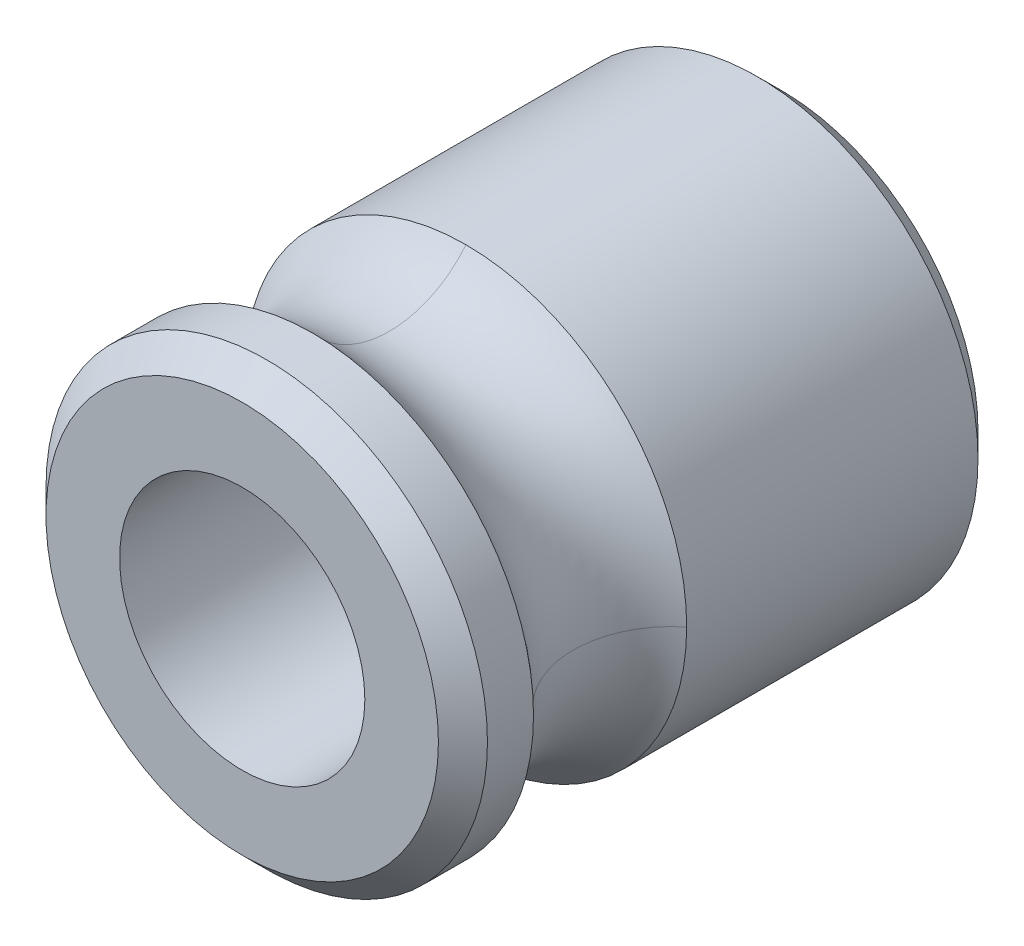
from build123d import *

# Parameters (mm, degrees)
CROQUIS1_R              = 4.5
CROQUIS1_R_2            = 2.5
SALIENTE_EXTRUIR1_DEPTH = 11
CHAFL_N1_SIZE           = 0.5


# Read off the part's stored shape, not the designer's step: Cortar-Barrer1
with BuildPart() as part:
    # Croquis1 → Saliente-Extruir1 (new body)
    with BuildSketch(Plane.XY):
        Circle(CROQUIS1_R)
        Circle(CROQUIS1_R_2, mode=Mode.SUBTRACT)
    extrude(amount=SALIENTE_EXTRUIR1_DEPTH)

    # Chaflán1
    chafl_n1_edges = [part.edges().sort_by_distance(p)[0] for p in [
        (-4.5, 0, 0),
        (-4.5, 0, 11),
    ]]
    chamfer(chafl_n1_edges, length=CHAFL_N1_SIZE)

    # Cortar-Barrer1 outline → Cortar-Barrer1 (revolve, cut)
    with BuildSketch(Plane.XZ):
        with BuildLine():
            Line((4.5, 6.4387505), (4.5, 9.5612495))
            ThreePointArc((4.5, 9.5612495), (3.75, 8), (4.5, 6.4387505))
        make_face()
    revolve(axis=Axis((0, 0, 0), (0, 0, 1)), mode=Mode.SUBTRACT)


solid = part.part
